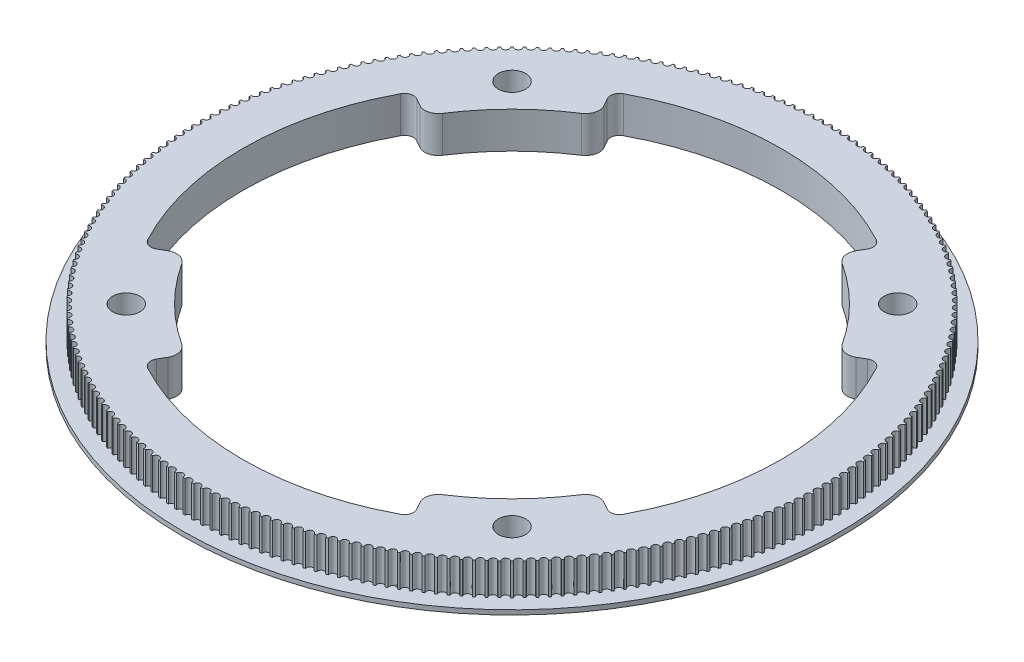
from build123d import *

# Parameters (mm, degrees)
BOSS_EXTRUDE1_DEPTH = 7
SKETCH3_R           = 72.5
BOSS_EXTRUDE3_DEPTH = 1
SKETCH6_R           = 3
CUT_EXTRUDE3_DEPTH  = 103.842111997
SKETCH7_R           = 50
CUT_EXTRUDE4_DEPTH  = 103.842111997
CUT_EXTRUDE5_DEPTH  = 103.842111997
SKETCH11_R          = 52.5
CUT_EXTRUDE6_DEPTH  = 10
FILLET1_R           = 3
FILLET2_R           = 2


with BuildPart() as part:
    # Sketch1 → Boss-Extrude1 (new body)
    with BuildSketch(Plane(origin=(0, 0, 0), x_dir=(1, 0, 0), z_dir=(0, 1, 0))):
        with BuildLine():
            ThreePointArc((-0.759988559, 69.250829904), (-0.988925477, 69.247938969), (-1.217851586, 69.244291191))
            ThreePointArc((-1.217851586, 69.244291191), (-1.955946699, 68.467067248), (-2.737208847, 69.200886647))
            ThreePointArc((-2.737208847, 69.200886647), (-2.965969848, 69.191459356), (-3.194698434, 69.18127584))
            ThreePointArc((-3.194698434, 69.18127584), (-3.9102981, 68.383291773), (-4.712196627, 69.094502154))
            ThreePointArc((-4.712196627, 69.094502154), (-4.940595132, 69.078546197), (-5.168939639, 69.061835249))
            ThreePointArc((-5.168939639, 69.061835249), (-5.861460206, 68.243741905), (-6.683341073, 68.931763195))
            ThreePointArc((-6.683341073, 68.931763195), (-6.911190796, 68.909291585), (-7.138964984, 68.886066835))
            ThreePointArc((-7.138964984, 68.886066835), (-7.80784162, 68.048531463), (-8.64903449, 68.7128025))
            ThreePointArc((-8.64903449, 68.7128025), (-8.876149594, 68.683833566), (-9.103167686, 68.654113956))
            ThreePointArc((-9.103167686, 68.654113956), (-9.747854848, 67.797819662), (-10.60767363, 68.437798658))
            ThreePointArc((-10.60767363, 68.437798658), (-10.833868876, 68.402356028), (-11.059945715, 68.366165797))
            ThreePointArc((-11.059945715, 68.366165797), (-11.679917584, 67.491810986), (-12.557660999, 68.106975966))
            ThreePointArc((-12.557660999, 68.106975966), (-12.7827519, 68.065088547), (-13.007703093, 68.022457213))
            ThreePointArc((-13.007703093, 68.022457213), (-13.602454013, 67.130755022), (-14.49740616, 67.720604247))
            ThreePointArc((-14.49740616, 67.720604247), (-14.721209128, 67.672306203), (-14.944851201, 67.623268537))
            ThreePointArc((-14.944851201, 67.623268537), (-15.513896085, 66.714946251), (-16.425327028, 67.278998633))
            ThreePointArc((-16.425327028, 67.278998633), (-16.647659527, 67.224329355), (-16.869810075, 67.168925353))
            ThreePointArc((-16.869810075, 67.168925353), (-17.412684801, 66.244723813), (-18.339851164, 66.782519302))
            ThreePointArc((-18.339851164, 66.782519302), (-18.560531855, 66.721523381), (-18.78100969, 66.65979823))
            ThreePointArc((-18.78100969, 66.65979823), (-19.297271481, 65.720471228), (-20.239417055, 66.23157119))
            ThreePointArc((-20.239417055, 66.23157119), (-20.458265948, 66.164298375), (-20.676891243, 66.096302419))
            ThreePointArc((-20.676891243, 66.096302419), (-21.16611903, 65.142616084), (-22.122475387, 65.626603659))
            ThreePointArc((-22.122475387, 65.626603659), (-22.339313986, 65.553108818), (-22.555908428, 65.478897517))
            ThreePointArc((-22.555908428, 65.478897517), (-23.017703188, 64.511629687), (-23.98749031, 64.968110128))
            ThreePointArc((-23.98749031, 64.968110128), (-24.202141758, 64.888453205), (-24.41652869, 64.808087086))
            ThreePointArc((-24.41652869, 64.808087086), (-24.850513778, 63.828026681), (-25.832940692, 64.256627675))
            ThreePointArc((-25.832940692, 64.256627675), (-26.045229917, 64.170873639), (-26.257234481, 64.08441825))
            ThreePointArc((-26.257234481, 64.08441825), (-26.663055932, 63.09236462), (-27.657321357, 63.492736595))
            ThreePointArc((-27.657321357, 63.492736595), (-27.867075212, 63.400955388), (-28.076524495, 63.308481243))
            ThreePointArc((-28.076524495, 63.308481243), (-28.453851316, 62.305243522), (-29.459144315, 62.677059928))
            ThreePointArc((-29.459144315, 62.677059928), (-29.666191722, 62.579326408), (-29.872914893, 62.48090893))
            ThreePointArc((-29.872914893, 62.48090893), (-30.22143933, 61.467305373), (-31.236939971, 61.810262952))
            ThreePointArc((-31.236939971, 61.810262952), (-31.441112059, 61.706656833), (-31.644940513, 61.602376293))
            ThreePointArc((-31.644940513, 61.602376293), (-31.964378304, 60.579233609), (-32.989258331, 60.893052639))
            ThreePointArc((-32.989258331, 60.893052639), (-33.190388575, 60.783658422), (-33.391156066, 60.673599873))
            ThreePointArc((-33.391156066, 60.673599873), (-33.681246674, 59.641752552), (-34.71467018, 59.926177079))
            ThreePointArc((-34.71467018, 59.926177079), (-34.912594534, 59.811083989), (-35.110137313, 59.695337195))
            ThreePointArc((-35.110137313, 59.695337195), (-35.370644135, 58.655626827), (-36.411768245, 58.910424869))
            ThreePointArc((-36.411768245, 58.910424869), (-36.60632528, 58.789726777), (-36.800482228, 58.668386144))
            ThreePointArc((-36.800482228, 58.668386144), (-37.031192792, 57.621660731), (-38.079168349, 57.846624472))
            ThreePointArc((-38.079168349, 57.846624472), (-38.270199382, 57.72041982), (-38.460812142, 57.593584316))
            ThreePointArc((-38.460812142, 57.593584316), (-38.661538276, 56.540697582), (-39.715510538, 56.735643538))
            ThreePointArc((-39.715510538, 56.735643538), (-39.902859761, 56.604035262), (-40.089772867, 56.471808334))
            ThreePointArc((-40.089772867, 56.471808334), (-40.260350856, 55.41361903), (-41.319460187, 55.5783882))
            ThreePointArc((-41.319460187, 55.5783882), (-41.502974794, 55.44148364), (-41.686035797, 55.303973135))
            ThreePointArc((-41.686035797, 55.303973135), (-41.826326516, 54.241344334), (-42.889709091, 54.375802331))
            ThreePointArc((-42.889709091, 54.375802331), (-43.069239406, 54.233713149), (-43.248298998, 54.091031223))
            ThreePointArc((-43.248298998, 54.091031223), (-43.358188024, 53.024829621), (-44.424976533, 53.128866777))
            ThreePointArc((-44.424976533, 53.128866777), (-44.600376129, 52.981708864), (-44.775288267, 52.833971889))
            ThreePointArc((-44.775288267, 52.833971889), (-44.854685972, 51.765067095), (-45.924010327, 51.838598558))
            ThreePointArc((-45.924010327, 51.838598558), (-46.095136145, 51.686491937), (-46.265758168, 51.533820411))
            ThreePointArc((-46.265758168, 51.533820411), (-46.314599794, 50.463084239), (-47.38558784, 50.506050034))
            ThreePointArc((-47.38558784, 50.506050034), (-47.552300307, 50.349118766), (-47.718493053, 50.191637209))
            ThreePointArc((-47.718493053, 50.191637209), (-47.736738765, 49.119942967), (-48.808516988, 49.132308051))
            ThreePointArc((-48.808516988, 49.132308051), (-48.970680131, 48.970680131), (-49.132308051, 48.808516988))
            ThreePointArc((-49.132308051, 48.808516988), (-49.119942967, 47.736738765), (-50.191637209, 47.718493053))
            ThreePointArc((-50.191637209, 47.718493053), (-50.349118766, 47.552300307), (-50.506050034, 47.38558784))
            ThreePointArc((-50.506050034, 47.38558784), (-50.463084239, 46.314599794), (-51.533820411, 46.265758168))
            ThreePointArc((-51.533820411, 46.265758168), (-51.686491937, 46.095136145), (-51.838598558, 45.924010327))
            ThreePointArc((-51.838598558, 45.924010327), (-51.765067095, 44.854685972), (-52.833971889, 44.775288267))
            ThreePointArc((-52.833971889, 44.775288267), (-52.981708864, 44.600376129), (-53.128866777, 44.424976533))
            ThreePointArc((-53.128866777, 44.424976533), (-53.024829621, 43.358188024), (-54.091031223, 43.248298998))
            ThreePointArc((-54.091031223, 43.248298998), (-54.233713149, 43.069239406), (-54.375802331, 42.889709091))
            ThreePointArc((-54.375802331, 42.889709091), (-54.241344334, 41.826326516), (-55.303973135, 41.686035797))
            ThreePointArc((-55.303973135, 41.686035797), (-55.44148364, 41.502974794), (-55.5783882, 41.319460187))
            ThreePointArc((-55.5783882, 41.319460187), (-55.41361903, 40.260350856), (-56.471808334, 40.089772867))
            ThreePointArc((-56.471808334, 40.089772867), (-56.604035262, 39.902859761), (-56.735643538, 39.715510538))
            ThreePointArc((-56.735643538, 39.715510538), (-56.540697582, 38.661538276), (-57.593584316, 38.460812142))
            ThreePointArc((-57.593584316, 38.460812142), (-57.72041982, 38.270199382), (-57.846624472, 38.079168349))
            ThreePointArc((-57.846624472, 38.079168349), (-57.621660731, 37.031192792), (-58.668386144, 36.800482228))
            ThreePointArc((-58.668386144, 36.800482228), (-58.789726777, 36.60632528), (-58.910424869, 36.411768245))
            ThreePointArc((-58.910424869, 36.411768245), (-58.655626827, 35.370644135), (-59.695337195, 35.110137313))
            ThreePointArc((-59.695337195, 35.110137313), (-59.811083989, 34.912594534), (-59.926177079, 34.71467018))
            ThreePointArc((-59.926177079, 34.71467018), (-59.641752552, 33.681246674), (-60.673599873, 33.391156066))
            ThreePointArc((-60.673599873, 33.391156066), (-60.783658422, 33.190388575), (-60.893052639, 32.989258331))
            ThreePointArc((-60.893052639, 32.989258331), (-60.579233609, 31.964378304), (-61.602376293, 31.644940513))
            ThreePointArc((-61.602376293, 31.644940513), (-61.706656833, 31.441112059), (-61.810262952, 31.236939971))
            ThreePointArc((-61.810262952, 31.236939971), (-61.467305373, 30.22143933), (-62.48090893, 29.872914893))
            ThreePointArc((-62.48090893, 29.872914893), (-62.579326408, 29.666191722), (-62.677059928, 29.459144315))
            ThreePointArc((-62.677059928, 29.459144315), (-62.305243522, 28.453851316), (-63.308481243, 28.076524495))
            ThreePointArc((-63.308481243, 28.076524495), (-63.400955388, 27.867075212), (-63.492736595, 27.657321357))
            ThreePointArc((-63.492736595, 27.657321357), (-63.09236462, 26.663055932), (-64.08441825, 26.257234481))
            ThreePointArc((-64.08441825, 26.257234481), (-64.170873639, 26.045229917), (-64.256627675, 25.832940692))
            ThreePointArc((-64.256627675, 25.832940692), (-63.828026681, 24.850513778), (-64.808087086, 24.41652869))
            ThreePointArc((-64.808087086, 24.41652869), (-64.888453205, 24.202141758), (-64.968110128, 23.98749031))
            ThreePointArc((-64.968110128, 23.98749031), (-64.511629687, 23.017703188), (-65.478897517, 22.555908428))
            ThreePointArc((-65.478897517, 22.555908428), (-65.553108818, 22.339313986), (-65.626603659, 22.122475387))
            ThreePointArc((-65.626603659, 22.122475387), (-65.142616084, 21.16611903), (-66.096302419, 20.676891243))
            ThreePointArc((-66.096302419, 20.676891243), (-66.164298375, 20.458265948), (-66.23157119, 20.239417055))
            ThreePointArc((-66.23157119, 20.239417055), (-65.720471228, 19.297271481), (-66.65979823, 18.78100969))
            ThreePointArc((-66.65979823, 18.78100969), (-66.721523381, 18.560531855), (-66.782519302, 18.339851164))
            ThreePointArc((-66.782519302, 18.339851164), (-66.244723813, 17.412684801), (-67.168925353, 16.869810075))
            ThreePointArc((-67.168925353, 16.869810075), (-67.224329355, 16.647659527), (-67.278998633, 16.425327028))
            ThreePointArc((-67.278998633, 16.425327028), (-66.714946251, 15.513896085), (-67.623268537, 14.944851201))
            ThreePointArc((-67.623268537, 14.944851201), (-67.672306203, 14.721209128), (-67.720604247, 14.49740616))
            ThreePointArc((-67.720604247, 14.49740616), (-67.130755022, 13.602454013), (-68.022457213, 13.007703093))
            ThreePointArc((-68.022457213, 13.007703093), (-68.065088547, 12.7827519), (-68.106975966, 12.557660999))
            ThreePointArc((-68.106975966, 12.557660999), (-67.491810986, 11.679917584), (-68.366165797, 11.059945715))
            ThreePointArc((-68.366165797, 11.059945715), (-68.402356028, 10.833868876), (-68.437798658, 10.60767363))
            ThreePointArc((-68.437798658, 10.60767363), (-67.797819662, 9.747854848), (-68.654113956, 9.103167686))
            ThreePointArc((-68.654113956, 9.103167686), (-68.683833566, 8.876149594), (-68.7128025, 8.64903449))
            ThreePointArc((-68.7128025, 8.64903449), (-68.048531463, 7.80784162), (-68.886066835, 7.138964984))
            ThreePointArc((-68.886066835, 7.138964984), (-68.909291585, 6.911190796), (-68.931763195, 6.683341073))
            ThreePointArc((-68.931763195, 6.683341073), (-68.243741905, 5.861460206), (-69.061835249, 5.168939639))
            ThreePointArc((-69.061835249, 5.168939639), (-69.078546197, 4.940595132), (-69.094502154, 4.712196627))
            ThreePointArc((-69.094502154, 4.712196627), (-68.383291773, 3.9102981), (-69.18127584, 3.194698434))
            ThreePointArc((-69.18127584, 3.194698434), (-69.191459356, 2.965969848), (-69.200886647, 2.737208847))
            ThreePointArc((-69.200886647, 2.737208847), (-68.467067248, 1.955946699), (-69.244291191, 1.217851586))
            ThreePointArc((-69.244291191, 1.217851586), (-69.247938969, 0.988925477), (-69.250829904, 0.759988559))
            ThreePointArc((-69.250829904, 0.759988559), (-68.495, 0), (-69.250829904, -0.759988559))
            ThreePointArc((-69.250829904, -0.759988559), (-69.247938969, -0.988925477), (-69.244291191, -1.217851586))
            ThreePointArc((-69.244291191, -1.217851586), (-68.467067248, -1.955946699), (-69.200886647, -2.737208847))
            ThreePointArc((-69.200886647, -2.737208847), (-69.191459356, -2.965969848), (-69.18127584, -3.194698434))
            ThreePointArc((-69.18127584, -3.194698434), (-68.383291773, -3.9102981), (-69.094502154, -4.712196627))
            ThreePointArc((-69.094502154, -4.712196627), (-69.078546197, -4.940595132), (-69.061835249, -5.168939639))
            ThreePointArc((-69.061835249, -5.168939639), (-68.243741905, -5.861460206), (-68.931763195, -6.683341073))
            ThreePointArc((-68.931763195, -6.683341073), (-68.909291585, -6.911190796), (-68.886066835, -7.138964984))
            ThreePointArc((-68.886066835, -7.138964984), (-68.048531463, -7.80784162), (-68.7128025, -8.64903449))
            ThreePointArc((-68.7128025, -8.64903449), (-68.683833566, -8.876149594), (-68.654113956, -9.103167686))
            ThreePointArc((-68.654113956, -9.103167686), (-67.797819662, -9.747854848), (-68.437798658, -10.60767363))
            ThreePointArc((-68.437798658, -10.60767363), (-68.402356028, -10.833868876), (-68.366165797, -11.059945715))
            ThreePointArc((-68.366165797, -11.059945715), (-67.491810986, -11.679917584), (-68.106975966, -12.557660999))
            ThreePointArc((-68.106975966, -12.557660999), (-68.065088547, -12.7827519), (-68.022457213, -13.007703093))
            ThreePointArc((-68.022457213, -13.007703093), (-67.130755022, -13.602454013), (-67.720604247, -14.49740616))
            ThreePointArc((-67.720604247, -14.49740616), (-67.672306203, -14.721209128), (-67.623268537, -14.944851201))
            ThreePointArc((-67.623268537, -14.944851201), (-66.714946251, -15.513896085), (-67.278998633, -16.425327028))
            ThreePointArc((-67.278998633, -16.425327028), (-67.224329355, -16.647659527), (-67.168925353, -16.869810075))
            ThreePointArc((-67.168925353, -16.869810075), (-66.244723813, -17.412684801), (-66.782519302, -18.339851164))
            ThreePointArc((-66.782519302, -18.339851164), (-66.721523381, -18.560531855), (-66.65979823, -18.78100969))
            ThreePointArc((-66.65979823, -18.78100969), (-65.720471228, -19.297271481), (-66.23157119, -20.239417055))
            ThreePointArc((-66.23157119, -20.239417055), (-66.164298375, -20.458265948), (-66.096302419, -20.676891243))
            ThreePointArc((-66.096302419, -20.676891243), (-65.142616084, -21.16611903), (-65.626603659, -22.122475387))
            ThreePointArc((-65.626603659, -22.122475387), (-65.553108818, -22.339313986), (-65.478897517, -22.555908428))
            ThreePointArc((-65.478897517, -22.555908428), (-64.511629687, -23.017703188), (-64.968110128, -23.98749031))
            ThreePointArc((-64.968110128, -23.98749031), (-64.888453205, -24.202141758), (-64.808087086, -24.41652869))
            ThreePointArc((-64.808087086, -24.41652869), (-63.828026681, -24.850513778), (-64.256627675, -25.832940692))
            ThreePointArc((-64.256627675, -25.832940692), (-64.170873639, -26.045229917), (-64.08441825, -26.257234481))
            ThreePointArc((-64.08441825, -26.257234481), (-63.09236462, -26.663055932), (-63.492736595, -27.657321357))
            ThreePointArc((-63.492736595, -27.657321357), (-63.400955388, -27.867075212), (-63.308481243, -28.076524495))
            ThreePointArc((-63.308481243, -28.076524495), (-62.305243522, -28.453851316), (-62.677059928, -29.459144315))
            ThreePointArc((-62.677059928, -29.459144315), (-62.579326408, -29.666191722), (-62.48090893, -29.872914893))
            ThreePointArc((-62.48090893, -29.872914893), (-61.467305373, -30.22143933), (-61.810262952, -31.236939971))
            ThreePointArc((-61.810262952, -31.236939971), (-61.706656833, -31.441112059), (-61.602376293, -31.644940513))
            ThreePointArc((-61.602376293, -31.644940513), (-60.579233609, -31.964378304), (-60.893052639, -32.989258331))
            ThreePointArc((-60.893052639, -32.989258331), (-60.783658422, -33.190388575), (-60.673599873, -33.391156066))
            ThreePointArc((-60.673599873, -33.391156066), (-59.641752552, -33.681246674), (-59.926177079, -34.71467018))
            ThreePointArc((-59.926177079, -34.71467018), (-59.811083989, -34.912594534), (-59.695337195, -35.110137313))
            ThreePointArc((-59.695337195, -35.110137313), (-58.655626827, -35.370644135), (-58.910424869, -36.411768245))
            ThreePointArc((-58.910424869, -36.411768245), (-58.789726777, -36.60632528), (-58.668386144, -36.800482228))
            ThreePointArc((-58.668386144, -36.800482228), (-57.621660731, -37.031192792), (-57.846624472, -38.079168349))
            ThreePointArc((-57.846624472, -38.079168349), (-57.72041982, -38.270199382), (-57.593584316, -38.460812142))
            ThreePointArc((-57.593584316, -38.460812142), (-56.540697582, -38.661538276), (-56.735643538, -39.715510538))
            ThreePointArc((-56.735643538, -39.715510538), (-56.604035262, -39.902859761), (-56.471808334, -40.089772867))
            ThreePointArc((-56.471808334, -40.089772867), (-55.41361903, -40.260350856), (-55.5783882, -41.319460187))
            ThreePointArc((-55.5783882, -41.319460187), (-55.44148364, -41.502974794), (-55.303973135, -41.686035797))
            ThreePointArc((-55.303973135, -41.686035797), (-54.241344334, -41.826326516), (-54.375802331, -42.889709091))
            ThreePointArc((-54.375802331, -42.889709091), (-54.233713149, -43.069239406), (-54.091031223, -43.248298998))
            ThreePointArc((-54.091031223, -43.248298998), (-53.024829621, -43.358188024), (-53.128866777, -44.424976533))
            ThreePointArc((-53.128866777, -44.424976533), (-52.981708864, -44.600376129), (-52.833971889, -44.775288267))
            ThreePointArc((-52.833971889, -44.775288267), (-51.765067095, -44.854685972), (-51.838598558, -45.924010327))
            ThreePointArc((-51.838598558, -45.924010327), (-51.686491937, -46.095136145), (-51.533820411, -46.265758168))
            ThreePointArc((-51.533820411, -46.265758168), (-50.463084239, -46.314599794), (-50.506050034, -47.38558784))
            ThreePointArc((-50.506050034, -47.38558784), (-50.349118766, -47.552300307), (-50.191637209, -47.718493053))
            ThreePointArc((-50.191637209, -47.718493053), (-49.119942967, -47.736738765), (-49.132308051, -48.808516988))
            ThreePointArc((-49.132308051, -48.808516988), (-48.970680131, -48.970680131), (-48.808516988, -49.132308051))
            ThreePointArc((-48.808516988, -49.132308051), (-47.736738765, -49.119942967), (-47.718493053, -50.191637209))
            ThreePointArc((-47.718493053, -50.191637209), (-47.552300307, -50.349118766), (-47.38558784, -50.506050034))
            ThreePointArc((-47.38558784, -50.506050034), (-46.314599794, -50.463084239), (-46.265758168, -51.533820411))
            ThreePointArc((-46.265758168, -51.533820411), (-46.095136145, -51.686491937), (-45.924010327, -51.838598558))
            ThreePointArc((-45.924010327, -51.838598558), (-44.854685972, -51.765067095), (-44.775288267, -52.833971889))
            ThreePointArc((-44.775288267, -52.833971889), (-44.600376129, -52.981708864), (-44.424976533, -53.128866777))
            ThreePointArc((-44.424976533, -53.128866777), (-43.358188024, -53.024829621), (-43.248298998, -54.091031223))
            ThreePointArc((-43.248298998, -54.091031223), (-43.069239406, -54.233713149), (-42.889709091, -54.375802331))
            ThreePointArc((-42.889709091, -54.375802331), (-41.826326516, -54.241344334), (-41.686035797, -55.303973135))
            ThreePointArc((-41.686035797, -55.303973135), (-41.502974794, -55.44148364), (-41.319460187, -55.5783882))
            ThreePointArc((-41.319460187, -55.5783882), (-40.260350856, -55.41361903), (-40.089772867, -56.471808334))
            ThreePointArc((-40.089772867, -56.471808334), (-39.902859761, -56.604035262), (-39.715510538, -56.735643538))
            ThreePointArc((-39.715510538, -56.735643538), (-38.661538276, -56.540697582), (-38.460812142, -57.593584316))
            ThreePointArc((-38.460812142, -57.593584316), (-38.270199382, -57.72041982), (-38.079168349, -57.846624472))
            ThreePointArc((-38.079168349, -57.846624472), (-37.031192792, -57.621660731), (-36.800482228, -58.668386144))
            ThreePointArc((-36.800482228, -58.668386144), (-36.60632528, -58.789726777), (-36.411768245, -58.910424869))
            ThreePointArc((-36.411768245, -58.910424869), (-35.370644135, -58.655626827), (-35.110137313, -59.695337195))
            ThreePointArc((-35.110137313, -59.695337195), (-34.912594534, -59.811083989), (-34.71467018, -59.926177079))
            ThreePointArc((-34.71467018, -59.926177079), (-33.681246674, -59.641752552), (-33.391156066, -60.673599873))
            ThreePointArc((-33.391156066, -60.673599873), (-33.190388575, -60.783658422), (-32.989258331, -60.893052639))
            ThreePointArc((-32.989258331, -60.893052639), (-31.964378304, -60.579233609), (-31.644940513, -61.602376293))
            ThreePointArc((-31.644940513, -61.602376293), (-31.441112059, -61.706656833), (-31.236939971, -61.810262952))
            ThreePointArc((-31.236939971, -61.810262952), (-30.22143933, -61.467305373), (-29.872914893, -62.48090893))
            ThreePointArc((-29.872914893, -62.48090893), (-29.666191722, -62.579326408), (-29.459144315, -62.677059928))
            ThreePointArc((-29.459144315, -62.677059928), (-28.453851316, -62.305243522), (-28.076524495, -63.308481243))
            ThreePointArc((-28.076524495, -63.308481243), (-27.867075212, -63.400955388), (-27.657321357, -63.492736595))
            ThreePointArc((-27.657321357, -63.492736595), (-26.663055932, -63.09236462), (-26.257234481, -64.08441825))
            ThreePointArc((-26.257234481, -64.08441825), (-26.045229917, -64.170873639), (-25.832940692, -64.256627675))
            ThreePointArc((-25.832940692, -64.256627675), (-24.850513778, -63.828026681), (-24.41652869, -64.808087086))
            ThreePointArc((-24.41652869, -64.808087086), (-24.202141758, -64.888453205), (-23.98749031, -64.968110128))
            ThreePointArc((-23.98749031, -64.968110128), (-23.017703188, -64.511629687), (-22.555908428, -65.478897517))
            ThreePointArc((-22.555908428, -65.478897517), (-22.339313986, -65.553108818), (-22.122475387, -65.626603659))
            ThreePointArc((-22.122475387, -65.626603659), (-21.16611903, -65.142616084), (-20.676891243, -66.096302419))
            ThreePointArc((-20.676891243, -66.096302419), (-20.458265948, -66.164298375), (-20.239417055, -66.23157119))
            ThreePointArc((-20.239417055, -66.23157119), (-19.297271481, -65.720471228), (-18.78100969, -66.65979823))
            ThreePointArc((-18.78100969, -66.65979823), (-18.560531855, -66.721523381), (-18.339851164, -66.782519302))
            ThreePointArc((-18.339851164, -66.782519302), (-17.412684801, -66.244723813), (-16.869810075, -67.168925353))
            ThreePointArc((-16.869810075, -67.168925353), (-16.647659527, -67.224329355), (-16.425327028, -67.278998633))
            ThreePointArc((-16.425327028, -67.278998633), (-15.513896085, -66.714946251), (-14.944851201, -67.623268537))
            ThreePointArc((-14.944851201, -67.623268537), (-14.721209128, -67.672306203), (-14.49740616, -67.720604247))
            ThreePointArc((-14.49740616, -67.720604247), (-13.602454013, -67.130755022), (-13.007703093, -68.022457213))
            ThreePointArc((-13.007703093, -68.022457213), (-12.7827519, -68.065088547), (-12.557660999, -68.106975966))
            ThreePointArc((-12.557660999, -68.106975966), (-11.679917584, -67.491810986), (-11.059945715, -68.366165797))
            ThreePointArc((-11.059945715, -68.366165797), (-10.833868876, -68.402356028), (-10.60767363, -68.437798658))
            ThreePointArc((-10.60767363, -68.437798658), (-9.747854848, -67.797819662), (-9.103167686, -68.654113956))
            ThreePointArc((-9.103167686, -68.654113956), (-8.876149594, -68.683833566), (-8.64903449, -68.7128025))
            ThreePointArc((-8.64903449, -68.7128025), (-7.80784162, -68.048531463), (-7.138964984, -68.886066835))
            ThreePointArc((-7.138964984, -68.886066835), (-6.911190796, -68.909291585), (-6.683341073, -68.931763195))
            ThreePointArc((-6.683341073, -68.931763195), (-5.861460206, -68.243741905), (-5.168939639, -69.061835249))
            ThreePointArc((-5.168939639, -69.061835249), (-4.940595132, -69.078546197), (-4.712196627, -69.094502154))
            ThreePointArc((-4.712196627, -69.094502154), (-3.9102981, -68.383291773), (-3.194698434, -69.18127584))
            ThreePointArc((-3.194698434, -69.18127584), (-2.965969848, -69.191459356), (-2.737208847, -69.200886647))
            ThreePointArc((-2.737208847, -69.200886647), (-1.955946699, -68.467067248), (-1.217851586, -69.244291191))
            ThreePointArc((-1.217851586, -69.244291191), (-0.988925477, -69.247938969), (-0.759988559, -69.250829904))
            ThreePointArc((-0.759988559, -69.250829904), (0, -68.495), (0.759988559, -69.250829904))
            ThreePointArc((0.759988559, -69.250829904), (0.988925477, -69.247938969), (1.217851586, -69.244291191))
            ThreePointArc((1.217851586, -69.244291191), (1.955946699, -68.467067248), (2.737208847, -69.200886647))
            ThreePointArc((2.737208847, -69.200886647), (2.965969848, -69.191459356), (3.194698434, -69.18127584))
            ThreePointArc((3.194698434, -69.18127584), (3.9102981, -68.383291773), (4.712196627, -69.094502154))
            ThreePointArc((4.712196627, -69.094502154), (4.940595132, -69.078546197), (5.168939639, -69.061835249))
            ThreePointArc((5.168939639, -69.061835249), (5.861460206, -68.243741905), (6.683341073, -68.931763195))
            ThreePointArc((6.683341073, -68.931763195), (6.911190796, -68.909291585), (7.138964984, -68.886066835))
            ThreePointArc((7.138964984, -68.886066835), (7.80784162, -68.048531463), (8.64903449, -68.7128025))
            ThreePointArc((8.64903449, -68.7128025), (8.876149594, -68.683833566), (9.103167686, -68.654113956))
            ThreePointArc((9.103167686, -68.654113956), (9.747854848, -67.797819662), (10.60767363, -68.437798658))
            ThreePointArc((10.60767363, -68.437798658), (10.833868876, -68.402356028), (11.059945715, -68.366165797))
            ThreePointArc((11.059945715, -68.366165797), (11.679917584, -67.491810986), (12.557660999, -68.106975966))
            ThreePointArc((12.557660999, -68.106975966), (12.7827519, -68.065088547), (13.007703093, -68.022457213))
            ThreePointArc((13.007703093, -68.022457213), (13.602454013, -67.130755022), (14.49740616, -67.720604247))
            ThreePointArc((14.49740616, -67.720604247), (14.721209128, -67.672306203), (14.944851201, -67.623268537))
            ThreePointArc((14.944851201, -67.623268537), (15.513896085, -66.714946251), (16.425327028, -67.278998633))
            ThreePointArc((16.425327028, -67.278998633), (16.647659527, -67.224329355), (16.869810075, -67.168925353))
            ThreePointArc((16.869810075, -67.168925353), (17.412684801, -66.244723813), (18.339851164, -66.782519302))
            ThreePointArc((18.339851164, -66.782519302), (18.560531855, -66.721523381), (18.78100969, -66.65979823))
            ThreePointArc((18.78100969, -66.65979823), (19.297271481, -65.720471228), (20.239417055, -66.23157119))
            ThreePointArc((20.239417055, -66.23157119), (20.458265948, -66.164298375), (20.676891243, -66.096302419))
            ThreePointArc((20.676891243, -66.096302419), (21.16611903, -65.142616084), (22.122475387, -65.626603659))
            ThreePointArc((22.122475387, -65.626603659), (22.339313986, -65.553108818), (22.555908428, -65.478897517))
            ThreePointArc((22.555908428, -65.478897517), (23.017703188, -64.511629687), (23.98749031, -64.968110128))
            ThreePointArc((23.98749031, -64.968110128), (24.202141758, -64.888453205), (24.41652869, -64.808087086))
            ThreePointArc((24.41652869, -64.808087086), (24.850513778, -63.828026681), (25.832940692, -64.256627675))
            ThreePointArc((25.832940692, -64.256627675), (26.045229917, -64.170873639), (26.257234481, -64.08441825))
            ThreePointArc((26.257234481, -64.08441825), (26.663055932, -63.09236462), (27.657321357, -63.492736595))
            ThreePointArc((27.657321357, -63.492736595), (27.867075212, -63.400955388), (28.076524495, -63.308481243))
            ThreePointArc((28.076524495, -63.308481243), (28.453851316, -62.305243522), (29.459144315, -62.677059928))
            ThreePointArc((29.459144315, -62.677059928), (29.666191722, -62.579326408), (29.872914893, -62.48090893))
            ThreePointArc((29.872914893, -62.48090893), (30.22143933, -61.467305373), (31.236939971, -61.810262952))
            ThreePointArc((31.236939971, -61.810262952), (31.441112059, -61.706656833), (31.644940513, -61.602376293))
            ThreePointArc((31.644940513, -61.602376293), (31.964378304, -60.579233609), (32.989258331, -60.893052639))
            ThreePointArc((32.989258331, -60.893052639), (33.190388575, -60.783658422), (33.391156066, -60.673599873))
            ThreePointArc((33.391156066, -60.673599873), (33.681246674, -59.641752552), (34.71467018, -59.926177079))
            ThreePointArc((34.71467018, -59.926177079), (34.912594534, -59.811083989), (35.110137313, -59.695337195))
            ThreePointArc((35.110137313, -59.695337195), (35.370644135, -58.655626827), (36.411768245, -58.910424869))
            ThreePointArc((36.411768245, -58.910424869), (36.60632528, -58.789726777), (36.800482228, -58.668386144))
            ThreePointArc((36.800482228, -58.668386144), (37.031192792, -57.621660731), (38.079168349, -57.846624472))
            ThreePointArc((38.079168349, -57.846624472), (38.270199382, -57.72041982), (38.460812142, -57.593584316))
            ThreePointArc((38.460812142, -57.593584316), (38.661538276, -56.540697582), (39.715510538, -56.735643538))
            ThreePointArc((39.715510538, -56.735643538), (39.902859761, -56.604035262), (40.089772867, -56.471808334))
            ThreePointArc((40.089772867, -56.471808334), (40.260350856, -55.41361903), (41.319460187, -55.5783882))
            ThreePointArc((41.319460187, -55.5783882), (41.502974794, -55.44148364), (41.686035797, -55.303973135))
            ThreePointArc((41.686035797, -55.303973135), (41.826326516, -54.241344334), (42.889709091, -54.375802331))
            ThreePointArc((42.889709091, -54.375802331), (43.069239406, -54.233713149), (43.248298998, -54.091031223))
            ThreePointArc((43.248298998, -54.091031223), (43.358188024, -53.024829621), (44.424976533, -53.128866777))
            ThreePointArc((44.424976533, -53.128866777), (44.600376129, -52.981708864), (44.775288267, -52.833971889))
            ThreePointArc((44.775288267, -52.833971889), (44.854685972, -51.765067095), (45.924010327, -51.838598558))
            ThreePointArc((45.924010327, -51.838598558), (46.095136145, -51.686491937), (46.265758168, -51.533820411))
            ThreePointArc((46.265758168, -51.533820411), (46.314599794, -50.463084239), (47.38558784, -50.506050034))
            ThreePointArc((47.38558784, -50.506050034), (47.552300307, -50.349118766), (47.718493053, -50.191637209))
            ThreePointArc((47.718493053, -50.191637209), (47.736738765, -49.119942967), (48.808516988, -49.132308051))
            ThreePointArc((48.808516988, -49.132308051), (48.970680131, -48.970680131), (49.132308051, -48.808516988))
            ThreePointArc((49.132308051, -48.808516988), (49.119942967, -47.736738765), (50.191637209, -47.718493053))
            ThreePointArc((50.191637209, -47.718493053), (50.349118766, -47.552300307), (50.506050034, -47.38558784))
            ThreePointArc((50.506050034, -47.38558784), (50.463084239, -46.314599794), (51.533820411, -46.265758168))
            ThreePointArc((51.533820411, -46.265758168), (51.686491937, -46.095136145), (51.838598558, -45.924010327))
            ThreePointArc((51.838598558, -45.924010327), (51.765067095, -44.854685972), (52.833971889, -44.775288267))
            ThreePointArc((52.833971889, -44.775288267), (52.981708864, -44.600376129), (53.128866777, -44.424976533))
            ThreePointArc((53.128866777, -44.424976533), (53.024829621, -43.358188024), (54.091031223, -43.248298998))
            ThreePointArc((54.091031223, -43.248298998), (54.233713149, -43.069239406), (54.375802331, -42.889709091))
            ThreePointArc((54.375802331, -42.889709091), (54.241344334, -41.826326516), (55.303973135, -41.686035797))
            ThreePointArc((55.303973135, -41.686035797), (55.44148364, -41.502974794), (55.5783882, -41.319460187))
            ThreePointArc((55.5783882, -41.319460187), (55.41361903, -40.260350856), (56.471808334, -40.089772867))
            ThreePointArc((56.471808334, -40.089772867), (56.604035262, -39.902859761), (56.735643538, -39.715510538))
            ThreePointArc((56.735643538, -39.715510538), (56.540697582, -38.661538276), (57.593584316, -38.460812142))
            ThreePointArc((57.593584316, -38.460812142), (57.72041982, -38.270199382), (57.846624472, -38.079168349))
            ThreePointArc((57.846624472, -38.079168349), (57.621660731, -37.031192792), (58.668386144, -36.800482228))
            ThreePointArc((58.668386144, -36.800482228), (58.789726777, -36.60632528), (58.910424869, -36.411768245))
            ThreePointArc((58.910424869, -36.411768245), (58.655626827, -35.370644135), (59.695337195, -35.110137313))
            ThreePointArc((59.695337195, -35.110137313), (59.811083989, -34.912594534), (59.926177079, -34.71467018))
            ThreePointArc((59.926177079, -34.71467018), (59.641752552, -33.681246674), (60.673599873, -33.391156066))
            ThreePointArc((60.673599873, -33.391156066), (60.783658422, -33.190388575), (60.893052639, -32.989258331))
            ThreePointArc((60.893052639, -32.989258331), (60.579233609, -31.964378304), (61.602376293, -31.644940513))
            ThreePointArc((61.602376293, -31.644940513), (61.706656833, -31.441112059), (61.810262952, -31.236939971))
            ThreePointArc((61.810262952, -31.236939971), (61.467305373, -30.22143933), (62.48090893, -29.872914893))
            ThreePointArc((62.48090893, -29.872914893), (62.579326408, -29.666191722), (62.677059928, -29.459144315))
            ThreePointArc((62.677059928, -29.459144315), (62.305243522, -28.453851316), (63.308481243, -28.076524495))
            ThreePointArc((63.308481243, -28.076524495), (63.400955388, -27.867075212), (63.492736595, -27.657321357))
            ThreePointArc((63.492736595, -27.657321357), (63.09236462, -26.663055932), (64.08441825, -26.257234481))
            ThreePointArc((64.08441825, -26.257234481), (64.170873639, -26.045229917), (64.256627675, -25.832940692))
            ThreePointArc((64.256627675, -25.832940692), (63.828026681, -24.850513778), (64.808087086, -24.41652869))
            ThreePointArc((64.808087086, -24.41652869), (64.888453205, -24.202141758), (64.968110128, -23.98749031))
            ThreePointArc((64.968110128, -23.98749031), (64.511629687, -23.017703188), (65.478897517, -22.555908428))
            ThreePointArc((65.478897517, -22.555908428), (65.553108818, -22.339313986), (65.626603659, -22.122475387))
            ThreePointArc((65.626603659, -22.122475387), (65.142616084, -21.16611903), (66.096302419, -20.676891243))
            ThreePointArc((66.096302419, -20.676891243), (66.164298375, -20.458265948), (66.23157119, -20.239417055))
            ThreePointArc((66.23157119, -20.239417055), (65.720471228, -19.297271481), (66.65979823, -18.78100969))
            ThreePointArc((66.65979823, -18.78100969), (66.721523381, -18.560531855), (66.782519302, -18.339851164))
            ThreePointArc((66.782519302, -18.339851164), (66.244723813, -17.412684801), (67.168925353, -16.869810075))
            ThreePointArc((67.168925353, -16.869810075), (67.224329355, -16.647659527), (67.278998633, -16.425327028))
            ThreePointArc((67.278998633, -16.425327028), (66.714946251, -15.513896085), (67.623268537, -14.944851201))
            ThreePointArc((67.623268537, -14.944851201), (67.672306203, -14.721209128), (67.720604247, -14.49740616))
            ThreePointArc((67.720604247, -14.49740616), (67.130755022, -13.602454013), (68.022457213, -13.007703093))
            ThreePointArc((68.022457213, -13.007703093), (68.065088547, -12.7827519), (68.106975966, -12.557660999))
            ThreePointArc((68.106975966, -12.557660999), (67.491810986, -11.679917584), (68.366165797, -11.059945715))
            ThreePointArc((68.366165797, -11.059945715), (68.402356028, -10.833868876), (68.437798658, -10.60767363))
            ThreePointArc((68.437798658, -10.60767363), (67.797819662, -9.747854848), (68.654113956, -9.103167686))
            ThreePointArc((68.654113956, -9.103167686), (68.683833566, -8.876149594), (68.7128025, -8.64903449))
            ThreePointArc((68.7128025, -8.64903449), (68.048531463, -7.80784162), (68.886066835, -7.138964984))
            ThreePointArc((68.886066835, -7.138964984), (68.909291585, -6.911190796), (68.931763195, -6.683341073))
            ThreePointArc((68.931763195, -6.683341073), (68.243741905, -5.861460206), (69.061835249, -5.168939639))
            ThreePointArc((69.061835249, -5.168939639), (69.078546197, -4.940595132), (69.094502154, -4.712196627))
            ThreePointArc((69.094502154, -4.712196627), (68.383291773, -3.9102981), (69.18127584, -3.194698434))
            ThreePointArc((69.18127584, -3.194698434), (69.191459356, -2.965969848), (69.200886647, -2.737208847))
            ThreePointArc((69.200886647, -2.737208847), (68.467067248, -1.955946699), (69.244291191, -1.217851586))
            ThreePointArc((69.244291191, -1.217851586), (69.247938969, -0.988925477), (69.250829904, -0.759988559))
            ThreePointArc((69.250829904, -0.759988559), (68.495, 0), (69.250829904, 0.759988559))
            ThreePointArc((69.250829904, 0.759988559), (69.247938969, 0.988925477), (69.244291191, 1.217851586))
            ThreePointArc((69.244291191, 1.217851586), (68.467067248, 1.955946699), (69.200886647, 2.737208847))
            ThreePointArc((69.200886647, 2.737208847), (69.191459356, 2.965969848), (69.18127584, 3.194698434))
            ThreePointArc((69.18127584, 3.194698434), (68.383291773, 3.9102981), (69.094502154, 4.712196627))
            ThreePointArc((69.094502154, 4.712196627), (69.078546197, 4.940595132), (69.061835249, 5.168939639))
            ThreePointArc((69.061835249, 5.168939639), (68.243741905, 5.861460206), (68.931763195, 6.683341073))
            ThreePointArc((68.931763195, 6.683341073), (68.909291585, 6.911190796), (68.886066835, 7.138964984))
            ThreePointArc((68.886066835, 7.138964984), (68.048531463, 7.80784162), (68.7128025, 8.64903449))
            ThreePointArc((68.7128025, 8.64903449), (68.683833566, 8.876149594), (68.654113956, 9.103167686))
            ThreePointArc((68.654113956, 9.103167686), (67.797819662, 9.747854848), (68.437798658, 10.60767363))
            ThreePointArc((68.437798658, 10.60767363), (68.402356028, 10.833868876), (68.366165797, 11.059945715))
            ThreePointArc((68.366165797, 11.059945715), (67.491810986, 11.679917584), (68.106975966, 12.557660999))
            ThreePointArc((68.106975966, 12.557660999), (68.065088547, 12.7827519), (68.022457213, 13.007703093))
            ThreePointArc((68.022457213, 13.007703093), (67.130755022, 13.602454013), (67.720604247, 14.49740616))
            ThreePointArc((67.720604247, 14.49740616), (67.672306203, 14.721209128), (67.623268537, 14.944851201))
            ThreePointArc((67.623268537, 14.944851201), (66.714946251, 15.513896085), (67.278998633, 16.425327028))
            ThreePointArc((67.278998633, 16.425327028), (67.224329355, 16.647659527), (67.168925353, 16.869810075))
            ThreePointArc((67.168925353, 16.869810075), (66.244723813, 17.412684801), (66.782519302, 18.339851164))
            ThreePointArc((66.782519302, 18.339851164), (66.721523381, 18.560531855), (66.65979823, 18.78100969))
            ThreePointArc((66.65979823, 18.78100969), (65.720471228, 19.297271481), (66.23157119, 20.239417055))
            ThreePointArc((66.23157119, 20.239417055), (66.164298375, 20.458265948), (66.096302419, 20.676891243))
            ThreePointArc((66.096302419, 20.676891243), (65.142616084, 21.16611903), (65.626603659, 22.122475387))
            ThreePointArc((65.626603659, 22.122475387), (65.553108818, 22.339313986), (65.478897517, 22.555908428))
            ThreePointArc((65.478897517, 22.555908428), (64.511629687, 23.017703188), (64.968110128, 23.98749031))
            ThreePointArc((64.968110128, 23.98749031), (64.888453205, 24.202141758), (64.808087086, 24.41652869))
            ThreePointArc((64.808087086, 24.41652869), (63.828026681, 24.850513778), (64.256627675, 25.832940692))
            ThreePointArc((64.256627675, 25.832940692), (64.170873639, 26.045229917), (64.08441825, 26.257234481))
            ThreePointArc((64.08441825, 26.257234481), (63.09236462, 26.663055932), (63.492736595, 27.657321357))
            ThreePointArc((63.492736595, 27.657321357), (63.400955388, 27.867075212), (63.308481243, 28.076524495))
            ThreePointArc((63.308481243, 28.076524495), (62.305243522, 28.453851316), (62.677059928, 29.459144315))
            ThreePointArc((62.677059928, 29.459144315), (62.579326408, 29.666191722), (62.48090893, 29.872914893))
            ThreePointArc((62.48090893, 29.872914893), (61.467305373, 30.22143933), (61.810262952, 31.236939971))
            ThreePointArc((61.810262952, 31.236939971), (61.706656833, 31.441112059), (61.602376293, 31.644940513))
            ThreePointArc((61.602376293, 31.644940513), (60.579233609, 31.964378304), (60.893052639, 32.989258331))
            ThreePointArc((60.893052639, 32.989258331), (60.783658422, 33.190388575), (60.673599873, 33.391156066))
            ThreePointArc((60.673599873, 33.391156066), (59.641752552, 33.681246674), (59.926177079, 34.71467018))
            ThreePointArc((59.926177079, 34.71467018), (59.811083989, 34.912594534), (59.695337195, 35.110137313))
            ThreePointArc((59.695337195, 35.110137313), (58.655626827, 35.370644135), (58.910424869, 36.411768245))
            ThreePointArc((58.910424869, 36.411768245), (58.789726777, 36.60632528), (58.668386144, 36.800482228))
            ThreePointArc((58.668386144, 36.800482228), (57.621660731, 37.031192792), (57.846624472, 38.079168349))
            ThreePointArc((57.846624472, 38.079168349), (57.72041982, 38.270199382), (57.593584316, 38.460812142))
            ThreePointArc((57.593584316, 38.460812142), (56.540697582, 38.661538276), (56.735643538, 39.715510538))
            ThreePointArc((56.735643538, 39.715510538), (56.604035262, 39.902859761), (56.471808334, 40.089772867))
            ThreePointArc((56.471808334, 40.089772867), (55.41361903, 40.260350856), (55.5783882, 41.319460187))
            ThreePointArc((55.5783882, 41.319460187), (55.44148364, 41.502974794), (55.303973135, 41.686035797))
            ThreePointArc((55.303973135, 41.686035797), (54.241344334, 41.826326516), (54.375802331, 42.889709091))
            ThreePointArc((54.375802331, 42.889709091), (54.233713149, 43.069239406), (54.091031223, 43.248298998))
            ThreePointArc((54.091031223, 43.248298998), (53.024829621, 43.358188024), (53.128866777, 44.424976533))
            ThreePointArc((53.128866777, 44.424976533), (52.981708864, 44.600376129), (52.833971889, 44.775288267))
            ThreePointArc((52.833971889, 44.775288267), (51.765067095, 44.854685972), (51.838598558, 45.924010327))
            ThreePointArc((51.838598558, 45.924010327), (51.686491937, 46.095136145), (51.533820411, 46.265758168))
            ThreePointArc((51.533820411, 46.265758168), (50.463084239, 46.314599794), (50.506050034, 47.38558784))
            ThreePointArc((50.506050034, 47.38558784), (50.349118766, 47.552300307), (50.191637209, 47.718493053))
            ThreePointArc((50.191637209, 47.718493053), (49.119942967, 47.736738765), (49.132308051, 48.808516988))
            ThreePointArc((49.132308051, 48.808516988), (48.970680131, 48.970680131), (48.808516988, 49.132308051))
            ThreePointArc((48.808516988, 49.132308051), (47.736738765, 49.119942967), (47.718493053, 50.191637209))
            ThreePointArc((47.718493053, 50.191637209), (47.552300307, 50.349118766), (47.38558784, 50.506050034))
            ThreePointArc((47.38558784, 50.506050034), (46.314599794, 50.463084239), (46.265758168, 51.533820411))
            ThreePointArc((46.265758168, 51.533820411), (46.095136145, 51.686491937), (45.924010327, 51.838598558))
            ThreePointArc((45.924010327, 51.838598558), (44.854685972, 51.765067095), (44.775288267, 52.833971889))
            ThreePointArc((44.775288267, 52.833971889), (44.600376129, 52.981708864), (44.424976533, 53.128866777))
            ThreePointArc((44.424976533, 53.128866777), (43.358188024, 53.024829621), (43.248298998, 54.091031223))
            ThreePointArc((43.248298998, 54.091031223), (43.069239406, 54.233713149), (42.889709091, 54.375802331))
            ThreePointArc((42.889709091, 54.375802331), (41.826326516, 54.241344334), (41.686035797, 55.303973135))
            ThreePointArc((41.686035797, 55.303973135), (41.502974794, 55.44148364), (41.319460187, 55.5783882))
            ThreePointArc((41.319460187, 55.5783882), (40.260350856, 55.41361903), (40.089772867, 56.471808334))
            ThreePointArc((40.089772867, 56.471808334), (39.902859761, 56.604035262), (39.715510538, 56.735643538))
            ThreePointArc((39.715510538, 56.735643538), (38.661538276, 56.540697582), (38.460812142, 57.593584316))
            ThreePointArc((38.460812142, 57.593584316), (38.270199382, 57.72041982), (38.079168349, 57.846624472))
            ThreePointArc((38.079168349, 57.846624472), (37.031192792, 57.621660731), (36.800482228, 58.668386144))
            ThreePointArc((36.800482228, 58.668386144), (36.60632528, 58.789726777), (36.411768245, 58.910424869))
            ThreePointArc((36.411768245, 58.910424869), (35.370644135, 58.655626827), (35.110137313, 59.695337195))
            ThreePointArc((35.110137313, 59.695337195), (34.912594534, 59.811083989), (34.71467018, 59.926177079))
            ThreePointArc((34.71467018, 59.926177079), (33.681246674, 59.641752552), (33.391156066, 60.673599873))
            ThreePointArc((33.391156066, 60.673599873), (33.190388575, 60.783658422), (32.989258331, 60.893052639))
            ThreePointArc((32.989258331, 60.893052639), (31.964378304, 60.579233609), (31.644940513, 61.602376293))
            ThreePointArc((31.644940513, 61.602376293), (31.441112059, 61.706656833), (31.236939971, 61.810262952))
            ThreePointArc((31.236939971, 61.810262952), (30.22143933, 61.467305373), (29.872914893, 62.48090893))
            ThreePointArc((29.872914893, 62.48090893), (29.666191722, 62.579326408), (29.459144315, 62.677059928))
            ThreePointArc((29.459144315, 62.677059928), (28.453851316, 62.305243522), (28.076524495, 63.308481243))
            ThreePointArc((28.076524495, 63.308481243), (27.867075212, 63.400955388), (27.657321357, 63.492736595))
            ThreePointArc((27.657321357, 63.492736595), (26.663055932, 63.09236462), (26.257234481, 64.08441825))
            ThreePointArc((26.257234481, 64.08441825), (26.045229917, 64.170873639), (25.832940692, 64.256627675))
            ThreePointArc((25.832940692, 64.256627675), (24.850513778, 63.828026681), (24.41652869, 64.808087086))
            ThreePointArc((24.41652869, 64.808087086), (24.202141758, 64.888453205), (23.98749031, 64.968110128))
            ThreePointArc((23.98749031, 64.968110128), (23.017703188, 64.511629687), (22.555908428, 65.478897517))
            ThreePointArc((22.555908428, 65.478897517), (22.339313986, 65.553108818), (22.122475387, 65.626603659))
            ThreePointArc((22.122475387, 65.626603659), (21.16611903, 65.142616084), (20.676891243, 66.096302419))
            ThreePointArc((20.676891243, 66.096302419), (20.458265948, 66.164298375), (20.239417055, 66.23157119))
            ThreePointArc((20.239417055, 66.23157119), (19.297271481, 65.720471228), (18.78100969, 66.65979823))
            ThreePointArc((18.78100969, 66.65979823), (18.560531855, 66.721523381), (18.339851164, 66.782519302))
            ThreePointArc((18.339851164, 66.782519302), (17.412684801, 66.244723813), (16.869810075, 67.168925353))
            ThreePointArc((16.869810075, 67.168925353), (16.647659527, 67.224329355), (16.425327028, 67.278998633))
            ThreePointArc((16.425327028, 67.278998633), (15.513896085, 66.714946251), (14.944851201, 67.623268537))
            ThreePointArc((14.944851201, 67.623268537), (14.721209128, 67.672306203), (14.49740616, 67.720604247))
            ThreePointArc((14.49740616, 67.720604247), (13.602454013, 67.130755022), (13.007703093, 68.022457213))
            ThreePointArc((13.007703093, 68.022457213), (12.7827519, 68.065088547), (12.557660999, 68.106975966))
            ThreePointArc((12.557660999, 68.106975966), (11.679917584, 67.491810986), (11.059945715, 68.366165797))
            ThreePointArc((11.059945715, 68.366165797), (10.833868876, 68.402356028), (10.60767363, 68.437798658))
            ThreePointArc((10.60767363, 68.437798658), (9.747854848, 67.797819662), (9.103167686, 68.654113956))
            ThreePointArc((9.103167686, 68.654113956), (8.876149594, 68.683833566), (8.64903449, 68.7128025))
            ThreePointArc((8.64903449, 68.7128025), (7.80784162, 68.048531463), (7.138964984, 68.886066835))
            ThreePointArc((7.138964984, 68.886066835), (6.911190796, 68.909291585), (6.683341073, 68.931763195))
            ThreePointArc((6.683341073, 68.931763195), (5.861460206, 68.243741905), (5.168939639, 69.061835249))
            ThreePointArc((5.168939639, 69.061835249), (4.940595132, 69.078546197), (4.712196627, 69.094502154))
            ThreePointArc((4.712196627, 69.094502154), (3.9102981, 68.383291773), (3.194698434, 69.18127584))
            ThreePointArc((3.194698434, 69.18127584), (2.965969848, 69.191459356), (2.737208847, 69.200886647))
            ThreePointArc((2.737208847, 69.200886647), (1.955946699, 68.467067248), (1.217851586, 69.244291191))
            ThreePointArc((1.217851586, 69.244291191), (0.988925477, 69.247938969), (0.759988559, 69.250829904))
            ThreePointArc((0.759988559, 69.250829904), (0, 68.495), (-0.759988559, 69.250829904))
        make_face()
    extrude(amount=BOSS_EXTRUDE1_DEPTH)

    # Sketch3 → Boss-Extrude3 (add)
    with BuildSketch(Plane.XZ):
        Circle(SKETCH3_R)
    extrude(amount=BOSS_EXTRUDE3_DEPTH)

    # Sketch6 → Cut-Extrude3 (cut, through all)
    with BuildSketch(Plane(origin=(0, 7, 0), x_dir=(1, 0, 0), z_dir=(0, 1, 0))):
        with Locations((42.425, 42.425)):
            Circle(SKETCH6_R)
        with Locations((42.425, -42.425)):
            Circle(SKETCH6_R)
        with Locations((-42.425, -42.425)):
            Circle(SKETCH6_R)
        with Locations((-42.425, 42.425)):
            Circle(SKETCH6_R)
    extrude(amount=-CUT_EXTRUDE3_DEPTH, mode=Mode.SUBTRACT)

    # Sketch7 → Cut-Extrude4 (cut, through all)
    with BuildSketch(Plane(origin=(0, 7, 0), x_dir=(1, 0, 0), z_dir=(0, 1, 0))):
        Circle(SKETCH7_R)
    extrude(amount=-CUT_EXTRUDE4_DEPTH, mode=Mode.SUBTRACT)

    # Sketch10 → Cut-Extrude5 (cut, through all)
    with BuildSketch(Plane(origin=(0, 7, 0), x_dir=(1, 0, 0), z_dir=(0, 1, 0))):
        with BuildLine():
            Line((-29.625, -51.312005174), (-25, -43.301270189))
            ThreePointArc((-25, -43.301270189), (0, -50), (25, -43.301270189))
            Line((25, -43.301270189), (29.625, -51.312005174))
            ThreePointArc((29.625, -51.312005174), (0, -59.25), (-29.625, -51.312005174))
        make_face()
        with BuildLine():
            Line((-43.301270189, -25), (-51.312005174, -29.625))
            ThreePointArc((-51.312005174, -29.625), (-59.25, 0), (-51.312005174, 29.625))
            Line((-51.312005174, 29.625), (-43.301270189, 25))
            ThreePointArc((-43.301270189, 25), (-50, 0), (-43.301270189, -25))
        make_face()
        with BuildLine():
            Line((43.301270189, -25), (51.312005174, -29.625))
            ThreePointArc((51.312005174, -29.625), (59.25, 0), (51.312005174, 29.625))
            Line((51.312005174, 29.625), (43.301270189, 25))
            ThreePointArc((43.301270189, 25), (50, 0), (43.301270189, -25))
        make_face()
        with BuildLine():
            Line((29.625, 51.312005174), (25, 43.301270189))
            ThreePointArc((25, 43.301270189), (0, 50), (-25, 43.301270189))
            Line((-25, 43.301270189), (-29.625, 51.312005174))
            ThreePointArc((-29.625, 51.312005174), (0, 59.25), (29.625, 51.312005174))
        make_face()
    extrude(amount=-CUT_EXTRUDE5_DEPTH, mode=Mode.SUBTRACT)

    # Sketch11 → Cut-Extrude6 (cut)
    with BuildSketch(Plane(origin=(0, 7, 0), x_dir=(1, 0, 0), z_dir=(0, 1, 0))):
        Circle(SKETCH11_R)
    extrude(amount=-CUT_EXTRUDE6_DEPTH, mode=Mode.SUBTRACT)

    # Fillet1
    fillet1_edges = [part.edges().sort_by_distance(p)[0] for p in [
        (26.25, 3, -45.466333699),
        (45.466333699, 3, -26.25),
        (-26.25, 3, -45.466333699),
        (-45.466333699, 3, -26.25),
        (-45.466333699, 3, 26.25),
        (-26.25, 3, 45.466333699),
        (26.25, 3, 45.466333699),
        (45.466333699, 3, 26.25),
    ]]
    fillet(fillet1_edges, radius=FILLET1_R)

    # Fillet2
    fillet2_edges = [part.edges().sort_by_distance(p)[0] for p in [
        (-29.625, 3, 51.312005174),
        (29.625, 3, 51.312005174),
        (51.312005174, 3, 29.625),
        (51.312005174, 3, -29.625),
        (29.625, 3, -51.312005174),
        (-29.625, 3, -51.312005174),
        (-51.312005174, 3, -29.625),
        (-51.312005174, 3, 29.625),
    ]]
    fillet(fillet2_edges, radius=FILLET2_R)


solid = part.part
